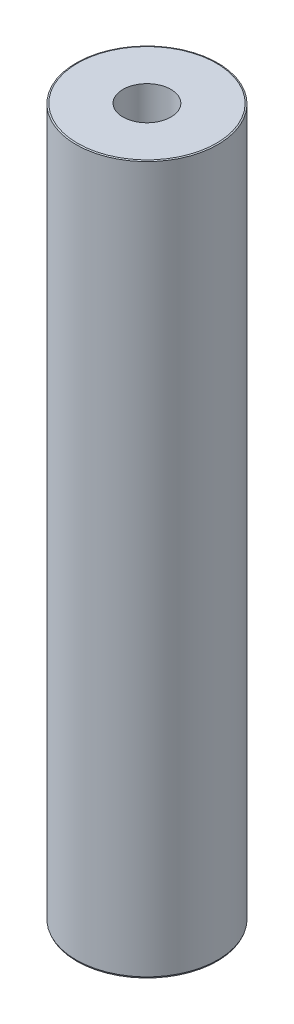
from build123d import *
from OCP.BRepFilletAPI import BRepFilletAPI_MakeChamfer

# Parameters (mm, degrees)
SKETCH1_R           = 60
BOSS_EXTRUDE1_DEPTH = 600
SKETCH2_R           = 20.334653794
CUT_EXTRUDE1_DEPTH  = 606.970296302
CHAMFER1_SIZE       = 0.427024332
CHAMFER1_SIZE2      = 1.14513133


with BuildPart() as part:
    # Sketch1 → Boss-Extrude1 (new body)
    with BuildSketch(Plane(origin=(0, 0, 0), x_dir=(1, 0, 0), z_dir=(0, 1, 0))):
        Circle(SKETCH1_R)
    extrude(amount=BOSS_EXTRUDE1_DEPTH)

    # Sketch2 → Cut-Extrude1 (cut, through all)
    with BuildSketch(Plane(origin=(0, 0, 0), x_dir=(1, 0, 0), z_dir=(0, 1, 0))):
        Circle(SKETCH2_R)
    extrude(amount=CUT_EXTRUDE1_DEPTH, mode=Mode.SUBTRACT)

    # Chamfer1: one chamfer whose edges measure the first distance from different faces: ONE call of the kernel's chamfer builder (chamfer() names one face for all edges)
    chamfer1_edges_1 = [part.edges().sort_by_distance(p)[0] for p in [
        (-60, 600, 0),
    ]]
    chamfer1_side_1 = [part.faces().sort_by_distance(p)[0] for p in [
        (-60, 300, 0),
    ]]
    chamfer1_edges_2 = [part.edges().sort_by_distance(p)[0] for p in [
        (-60, 0, 0),
    ]]
    chamfer1_side_2 = [part.faces().sort_by_distance(p)[0] for p in [
        (-58.302943725, 0, 0),
    ]]
    chamfer1 = BRepFilletAPI_MakeChamfer(part.part.solid().wrapped)
    for e in chamfer1_edges_1:
        chamfer1.Add(CHAMFER1_SIZE, CHAMFER1_SIZE2, e.wrapped, chamfer1_side_1[0].wrapped)  # the first distance lies on this face
    for e in chamfer1_edges_2:
        chamfer1.Add(CHAMFER1_SIZE, CHAMFER1_SIZE2, e.wrapped, chamfer1_side_2[0].wrapped)  # the first distance lies on this face
    add(Compound.cast(chamfer1.Shape()), mode=Mode.REPLACE)


solid = part.part
